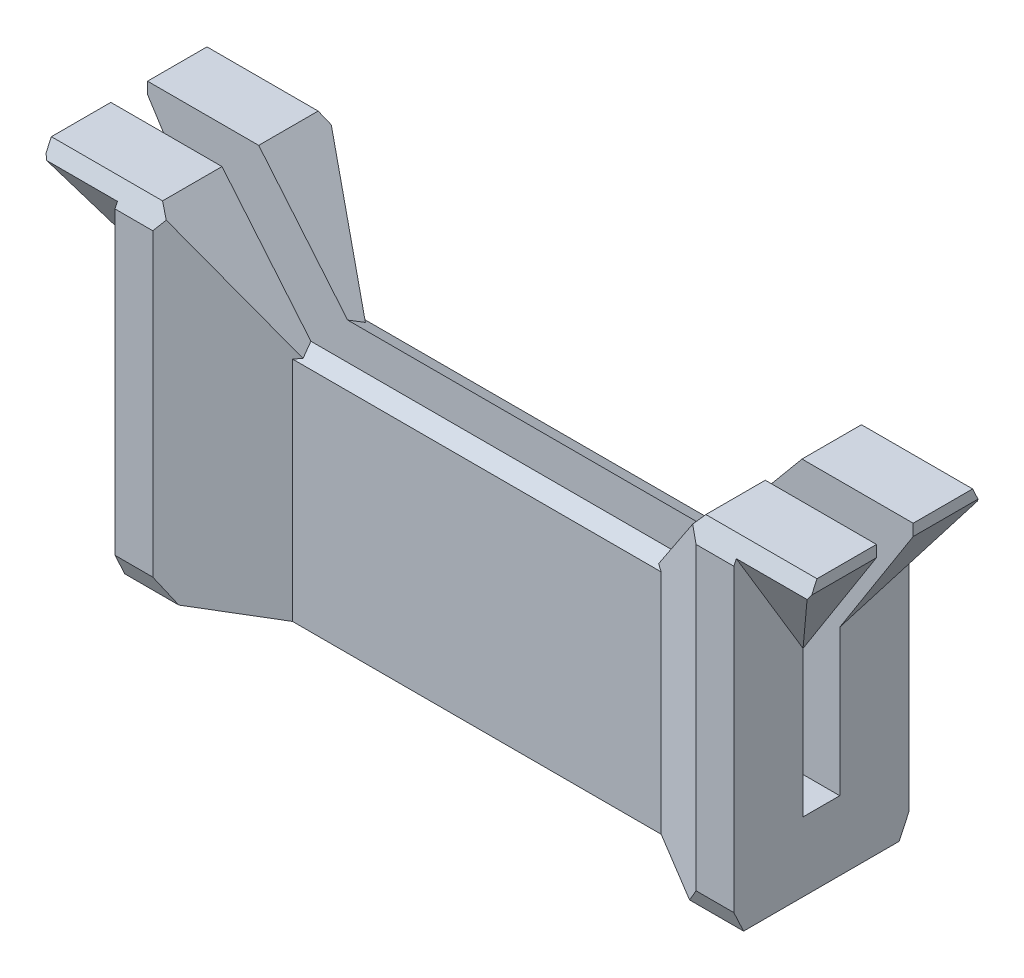
from build123d import *

# Parameters (mm, degrees)
SALIENTE_EXTRUIR1_DEPTH = 18.25
CORTAR_EXTRUIR1_START   = -1.8
CORTAR_EXTRUIR1_DEPTH   = 1.7
CORTAR_EXTRUIR2_DEPTH   = 25.823036176
CORTAR_EXTRUIR3_DEPTH   = 24.912026263
CORTAR_EXTRUIR4_REACH   = 37.713
CORTAR_EXTRUIR5_DEPTH   = 10
CHAFL_N2_SIZE           = 1
CHAFL_N2_SIZE_2         = 0.466307658


with BuildPart() as part:
    # Croquis2 → Saliente-Extruir1 (new, symmetric)
    with BuildSketch(Plane(origin=(0, 0, 0), x_dir=(0, 0, -1), z_dir=(1, 0, 0))):
        Polygon((0.875, 0), (0, 0), (0, -3.3), (0.875, -3.3), (4.175, 2.192122292), (4.175, 13), (0.875, 13), align=None)
        Polygon((0, 0), (-0.875, 0), (-0.875, 13), (-4.175, 13), (-4.175, 2.192122292), (-0.875, -3.3), (0, -3.3), align=None)
        Polygon((-4.175, -3.3), (-4.175, 2.192122292), (-0.875, -3.3), align=None)
        Polygon((4.175, -3.3), (0.875, -3.3), (4.175, 2.192122292), align=None)
    extrude(amount=SALIENTE_EXTRUIR1_DEPTH, both=True)

    # Croquis3 → Cortar-Extruir1 (cut)
    with BuildSketch(Plane(origin=(18.25, 0, 0), x_dir=(0, 0, -1), z_dir=(1, 0, 0)).offset(CORTAR_EXTRUIR1_START)):
        Polygon((0, -3.3), (0, 0), (-0.875, 0), (-0.875, 6.957676858), (-4.175, 12.449799149), (-4.175, -3.3), align=None)
        Polygon((0.875, 0), (0, 0), (0, -3.3), (4.175, -3.3), (4.175, 12.449799149), (0.875, 6.957676858), align=None)
    cortar_extruir1 = extrude(amount=-CORTAR_EXTRUIR1_DEPTH, mode=Mode.SUBTRACT)

    # Simetría1: Cortar-Extruir1 across plane
    add(cortar_extruir1.mirror(Plane(origin=(0, 0, 0), x_dir=(0, 0, 1), z_dir=(1, 0, 0))), mode=Mode.SUBTRACT)

    # Croquis4 → Cortar-Extruir2 (cut, through all)
    with BuildSketch(Plane(origin=(0, 13, 0), x_dir=(1, 0, 0), z_dir=(0, 1, 0))):
        Polygon((8.789301294, -1.675), (-8.789301294, -1.675), (-12.95, -4.175), (12.95, -4.175), align=None)
        Polygon((8.789301294, 1.675), (12.95, 4.175), (-12.95, 4.175), (-8.789301294, 1.675), align=None)
    extrude(amount=-CORTAR_EXTRUIR2_DEPTH, mode=Mode.SUBTRACT)

    # Croquis5 → Cortar-Extruir3 (cut, through all)
    with BuildSketch(Plane.XY.offset(4.175)):
        Polygon((-12.95, 13), (12.95, 13), (8.789301294, 8), (-8.789301294, 8), align=None)
    extrude(amount=-CORTAR_EXTRUIR3_DEPTH, mode=Mode.SUBTRACT)

    # Croquis6 → Cortar-Extruir4 (cut, up to next)
    with BuildSketch(Plane(origin=(14.75, 0, 0), x_dir=(0, 0, -1), z_dir=(1, 0, 0)), mode=Mode.PRIVATE) as cortar_extruir4_sk1:
        Polygon((-4.175, -3.3), (4.175, -3.3), (4.175, 12.449799149), (0.875, 6.957676858), (0.875, 0), (-0.875, 0), (-0.875, 6.957676858), (-4.175, 12.449799149), align=None)
    cortar_extruir4_tool1 = extrude(cortar_extruir4_sk1.sketch, amount=CORTAR_EXTRUIR4_REACH, mode=Mode.PRIVATE) & part.part
    cortar_extruir4 = cortar_extruir4_tool1.solids().sort_by_distance((14.75, -3.121737, 0))[0]
    add(cortar_extruir4, mode=Mode.SUBTRACT)

    # Simetría2: Cortar-Extruir4 across plane
    add(cortar_extruir4.mirror(Plane(origin=(0, 0, 0), x_dir=(0, 0, 1), z_dir=(1, 0, 0))), mode=Mode.SUBTRACT)

    # Croquis7 → Cortar-Extruir5 (cut)
    with BuildSketch(Plane(origin=(0, 0, -4.175), x_dir=(-1, 0, 0), z_dir=(0, 0, -1))):
        Polygon((14.75, 6.957676858), (18.25, 12.449799149), (18.25, 6.957676858), align=None)
        Polygon((-18.25, 6.957676858), (-14.75, 6.957676858), (-18.25, 12.449799149), align=None)
    extrude(amount=-CORTAR_EXTRUIR5_DEPTH, mode=Mode.SUBTRACT)

    # Chaflán2
    # the kernel refuses this chamfer: 1, 0.466307658 mm, written as the material it takes off along each edge
    with BuildSketch(Plane(origin=(-11.380276766, 8, 1.675), x_dir=(0, 0.01631116413111048, -0.9998669641130704), z_dir=(1, 0, 0))) as chafl_n2_piece_1_section:
        Polygon((CHAFL_N2_SIZE * 0.999866964113, -CHAFL_N2_SIZE * 0.0163111641311), (-CHAFL_N2_SIZE_2 * 0.0163111641365, -CHAFL_N2_SIZE_2 * 0.999866964445), (0, 0), align=None)
    chafl_n2_piece_1 = extrude(amount=22.760553531, mode=Mode.PRIVATE)
    chafl_n2_piece_1 = split(chafl_n2_piece_1, bisect_by=Plane(origin=(-8.557096722, 7.720954834, 1.652220127), z_dir=(-0.7686723090596509, -0.6396427763094841, 0)), keep=Keep.TOP, mode=Mode.PRIVATE)
    chafl_n2_piece_1 = split(chafl_n2_piece_1, bisect_by=Plane(origin=(-8.661655422, 7.660906137, 1.598302622), z_dir=(0.5150380749100552, 0, 0.8571673007021118)), keep=Keep.TOP, mode=Mode.PRIVATE)
    add(chafl_n2_piece_1, mode=Mode.SUBTRACT)
    with BuildSketch(Plane(origin=(-11.380276766, 8, 1.675), x_dir=(0, 0.01631116413111048, -0.9998669641130704), z_dir=(1, 0, 0))) as chafl_n2_piece_2_section:
        Polygon((CHAFL_N2_SIZE * 0.999866964113, -CHAFL_N2_SIZE * 0.0163111641311), (-CHAFL_N2_SIZE_2 * 0.0163111641365, -CHAFL_N2_SIZE_2 * 0.999866964445), (0, 0), align=None)
    chafl_n2_piece_2 = extrude(amount=22.760553531, mode=Mode.PRIVATE)
    chafl_n2_piece_2 = split(chafl_n2_piece_2, bisect_by=Plane(origin=(-8.541684452, 7.702433581, 1.094162821), z_dir=(0.7686723090596509, 0.6396427763094841, 0)), keep=Keep.TOP, mode=Mode.PRIVATE)
    chafl_n2_piece_2 = split(chafl_n2_piece_2, bisect_by=Plane(origin=(-8.154722375, 7.924668255, 1.293706518), z_dir=(-0.5150380749100552, 0, -0.8571673007021118)), keep=Keep.TOP, mode=Mode.PRIVATE)
    add(chafl_n2_piece_2, mode=Mode.SUBTRACT)
    with BuildSketch(Plane(origin=(-11.380276766, 8, 1.675), x_dir=(0, 0.01631116413111048, -0.9998669641130704), z_dir=(1, 0, 0))) as chafl_n2_piece_3_section:
        Polygon((CHAFL_N2_SIZE * 0.999866964113, -CHAFL_N2_SIZE * 0.0163111641311), (-CHAFL_N2_SIZE_2 * 0.0163111641365, -CHAFL_N2_SIZE_2 * 0.999866964445), (0, 0), align=None)
    chafl_n2_piece_3 = extrude(amount=22.760553531, mode=Mode.PRIVATE)
    chafl_n2_piece_3 = split(chafl_n2_piece_3, bisect_by=Plane(origin=(-5.119611659, 3.590056028, 1.349077222), z_dir=(0.7686723090596509, 0.6396427763094841, 0)), keep=Keep.TOP, mode=Mode.PRIVATE)
    chafl_n2_piece_3 = split(chafl_n2_piece_3, bisect_by=Plane(origin=(5.119611659, 3.590056028, 1.349077222), z_dir=(-0.768672309059651, 0.6396427763094839, 0)), keep=Keep.TOP, mode=Mode.PRIVATE)
    chafl_n2_piece_3 = split(chafl_n2_piece_3, bisect_by=Plane(origin=(2.187600774, 7.850288348, -2.291701861), z_dir=(-0.5150380749100552, 0, 0.8571673007021118)), keep=Keep.TOP, mode=Mode.PRIVATE)
    chafl_n2_piece_3 = split(chafl_n2_piece_3, bisect_by=Plane(origin=(-2.187600774, 7.850288348, -2.291701861), z_dir=(0.5150380749100552, 0, 0.8571673007021118)), keep=Keep.TOP, mode=Mode.PRIVATE)
    add(chafl_n2_piece_3, mode=Mode.SUBTRACT)
    with BuildSketch(Plane(origin=(-11.380276766, 8, 1.675), x_dir=(0, 0.01631116413111048, -0.9998669641130704), z_dir=(1, 0, 0))) as chafl_n2_piece_4_section:
        Polygon((CHAFL_N2_SIZE * 0.999866964113, -CHAFL_N2_SIZE * 0.0163111641311), (-CHAFL_N2_SIZE_2 * 0.0163111641365, -CHAFL_N2_SIZE_2 * 0.999866964445), (0, 0), align=None)
    chafl_n2_piece_4 = extrude(amount=22.760553531, mode=Mode.PRIVATE)
    chafl_n2_piece_4 = split(chafl_n2_piece_4, bisect_by=Plane(origin=(8.557096722, 7.720954834, 1.652220127), z_dir=(0.768672309059651, -0.6396427763094839, 0)), keep=Keep.TOP, mode=Mode.PRIVATE)
    chafl_n2_piece_4 = split(chafl_n2_piece_4, bisect_by=Plane(origin=(8.661655422, 7.660906137, 1.598302622), z_dir=(-0.5150380749100552, 0, 0.8571673007021118)), keep=Keep.TOP, mode=Mode.PRIVATE)
    add(chafl_n2_piece_4, mode=Mode.SUBTRACT)
    with BuildSketch(Plane(origin=(-11.380276766, 8, 1.675), x_dir=(0, 0.01631116413111048, -0.9998669641130704), z_dir=(1, 0, 0))) as chafl_n2_piece_5_section:
        Polygon((CHAFL_N2_SIZE * 0.999866964113, -CHAFL_N2_SIZE * 0.0163111641311), (-CHAFL_N2_SIZE_2 * 0.0163111641365, -CHAFL_N2_SIZE_2 * 0.999866964445), (0, 0), align=None)
    chafl_n2_piece_5 = extrude(amount=22.760553531, mode=Mode.PRIVATE)
    chafl_n2_piece_5 = split(chafl_n2_piece_5, bisect_by=Plane(origin=(8.541684452, 7.702433581, 1.094162821), z_dir=(-0.768672309059651, 0.6396427763094839, 0)), keep=Keep.TOP, mode=Mode.PRIVATE)
    chafl_n2_piece_5 = split(chafl_n2_piece_5, bisect_by=Plane(origin=(8.154722375, 7.924668255, 1.293706518), z_dir=(0.5150380749100552, 0, -0.8571673007021118)), keep=Keep.TOP, mode=Mode.PRIVATE)
    add(chafl_n2_piece_5, mode=Mode.SUBTRACT)
    with BuildSketch(Plane(origin=(11.380276766, 8, -1.675), x_dir=(0, -0.9971975577536775, -0.0748133063705994), z_dir=(-1, 0, 0))) as chafl_n2_piece_6_section:
        Polygon((CHAFL_N2_SIZE_2 * 0.997197558085, CHAFL_N2_SIZE_2 * 0.0748133063955), (-CHAFL_N2_SIZE * 0.0748133063706, CHAFL_N2_SIZE * 0.997197557754), (0, 0), align=None)
    chafl_n2_piece_6 = extrude(amount=22.760553531, mode=Mode.PRIVATE)
    chafl_n2_piece_6 = split(chafl_n2_piece_6, bisect_by=Plane(origin=(8.541684452, 7.702433581, -1.094162821), z_dir=(-0.768672309059651, 0.6396427763094839, 0)), keep=Keep.TOP, mode=Mode.PRIVATE)
    chafl_n2_piece_6 = split(chafl_n2_piece_6, bisect_by=Plane(origin=(8.154722375, 7.924668255, -1.293706518), z_dir=(0.5150380749100552, 0, 0.8571673007021118)), keep=Keep.TOP, mode=Mode.PRIVATE)
    add(chafl_n2_piece_6, mode=Mode.SUBTRACT)
    with BuildSketch(Plane(origin=(11.380276766, 8, -1.675), x_dir=(0, -0.9971975577536775, -0.0748133063705994), z_dir=(-1, 0, 0))) as chafl_n2_piece_7_section:
        Polygon((CHAFL_N2_SIZE_2 * 0.997197558085, CHAFL_N2_SIZE_2 * 0.0748133063955), (-CHAFL_N2_SIZE * 0.0748133063706, CHAFL_N2_SIZE * 0.997197557754), (0, 0), align=None)
    chafl_n2_piece_7 = extrude(amount=22.760553531, mode=Mode.PRIVATE)
    chafl_n2_piece_7 = split(chafl_n2_piece_7, bisect_by=Plane(origin=(8.557096722, 7.720954834, -1.652220127), z_dir=(0.768672309059651, -0.6396427763094839, 0)), keep=Keep.TOP, mode=Mode.PRIVATE)
    chafl_n2_piece_7 = split(chafl_n2_piece_7, bisect_by=Plane(origin=(8.661655422, 7.660906137, -1.598302622), z_dir=(-0.5150380749100552, 0, -0.8571673007021118)), keep=Keep.TOP, mode=Mode.PRIVATE)
    add(chafl_n2_piece_7, mode=Mode.SUBTRACT)
    with BuildSketch(Plane(origin=(11.380276766, 8, -1.675), x_dir=(0, -0.9971975577536775, -0.0748133063705994), z_dir=(-1, 0, 0))) as chafl_n2_piece_8_section:
        Polygon((CHAFL_N2_SIZE_2 * 0.997197558085, CHAFL_N2_SIZE_2 * 0.0748133063955), (-CHAFL_N2_SIZE * 0.0748133063706, CHAFL_N2_SIZE * 0.997197557754), (0, 0), align=None)
    chafl_n2_piece_8 = extrude(amount=22.760553531, mode=Mode.PRIVATE)
    chafl_n2_piece_8 = split(chafl_n2_piece_8, bisect_by=Plane(origin=(5.119611659, 3.590056028, -1.349077222), z_dir=(-0.768672309059651, 0.6396427763094839, 0)), keep=Keep.TOP, mode=Mode.PRIVATE)
    chafl_n2_piece_8 = split(chafl_n2_piece_8, bisect_by=Plane(origin=(2.187600774, 7.850288348, 2.291701861), z_dir=(-0.5150380749100552, 0, -0.8571673007021118)), keep=Keep.TOP, mode=Mode.PRIVATE)
    chafl_n2_piece_8 = split(chafl_n2_piece_8, bisect_by=Plane(origin=(-2.187600774, 7.850288348, 2.291701861), z_dir=(0.5150380749100552, 0, -0.8571673007021118)), keep=Keep.TOP, mode=Mode.PRIVATE)
    chafl_n2_piece_8 = split(chafl_n2_piece_8, bisect_by=Plane(origin=(-5.119611659, 3.590056028, -1.349077222), z_dir=(0.7686723090596509, 0.6396427763094841, 0)), keep=Keep.TOP, mode=Mode.PRIVATE)
    add(chafl_n2_piece_8, mode=Mode.SUBTRACT)
    with BuildSketch(Plane(origin=(11.380276766, 8, -1.675), x_dir=(0, -0.9971975577536775, -0.0748133063705994), z_dir=(-1, 0, 0))) as chafl_n2_piece_9_section:
        Polygon((CHAFL_N2_SIZE_2 * 0.997197558085, CHAFL_N2_SIZE_2 * 0.0748133063955), (-CHAFL_N2_SIZE * 0.0748133063706, CHAFL_N2_SIZE * 0.997197557754), (0, 0), align=None)
    chafl_n2_piece_9 = extrude(amount=22.760553531, mode=Mode.PRIVATE)
    chafl_n2_piece_9 = split(chafl_n2_piece_9, bisect_by=Plane(origin=(-8.154722375, 7.924668255, -1.293706518), z_dir=(-0.5150380749100552, 0, 0.8571673007021118)), keep=Keep.TOP, mode=Mode.PRIVATE)
    chafl_n2_piece_9 = split(chafl_n2_piece_9, bisect_by=Plane(origin=(-8.541684452, 7.702433581, -1.094162821), z_dir=(0.7686723090596509, 0.6396427763094841, 0)), keep=Keep.TOP, mode=Mode.PRIVATE)
    add(chafl_n2_piece_9, mode=Mode.SUBTRACT)
    with BuildSketch(Plane(origin=(11.380276766, 8, -1.675), x_dir=(0, -0.9971975577536775, -0.0748133063705994), z_dir=(-1, 0, 0))) as chafl_n2_piece_10_section:
        Polygon((CHAFL_N2_SIZE_2 * 0.997197558085, CHAFL_N2_SIZE_2 * 0.0748133063955), (-CHAFL_N2_SIZE * 0.0748133063706, CHAFL_N2_SIZE * 0.997197557754), (0, 0), align=None)
    chafl_n2_piece_10 = extrude(amount=22.760553531, mode=Mode.PRIVATE)
    chafl_n2_piece_10 = split(chafl_n2_piece_10, bisect_by=Plane(origin=(-8.661655422, 7.660906137, -1.598302622), z_dir=(0.5150380749100552, 0, -0.8571673007021118)), keep=Keep.TOP, mode=Mode.PRIVATE)
    chafl_n2_piece_10 = split(chafl_n2_piece_10, bisect_by=Plane(origin=(-8.557096722, 7.720954834, -1.652220127), z_dir=(-0.7686723090596509, -0.6396427763094841, 0)), keep=Keep.TOP, mode=Mode.PRIVATE)
    add(chafl_n2_piece_10, mode=Mode.SUBTRACT)
    with BuildSketch(Plane(origin=(20.840975471, 13, 4.175), x_dir=(0, -0.9998669641130704, 0.016311164131110487), z_dir=(-1, 0, 0)), Plane(origin=(-20.840975471, 13, -4.175), x_dir=(0, -0.9998669641130704, -0.016311164131110487), z_dir=(1, 0, 0))) as chafl_n2_piece_11:
        Polygon((CHAFL_N2_SIZE * 0.999866964113, -CHAFL_N2_SIZE * 0.0163111641311), (-CHAFL_N2_SIZE_2 * 0.0163111641365, -CHAFL_N2_SIZE_2 * 0.999866964445), (0, 0), align=None)
    extrude(amount=10.481950943, mode=Mode.SUBTRACT)
    with BuildSketch(Plane(origin=(10.359024529, -3.3, 4.175), x_dir=(0, 0.9998669641130704, 0.01631116413111048), z_dir=(1, 0, 0)), Plane(origin=(-17.340975471, -3.3, 4.175), x_dir=(0, 0.9998669641130704, 0.01631116413111048), z_dir=(1, 0, 0))) as chafl_n2_piece_12:
        Polygon((CHAFL_N2_SIZE * 0.999866964113, -CHAFL_N2_SIZE * 0.0163111641311), (-CHAFL_N2_SIZE_2 * 0.0163111641365, -CHAFL_N2_SIZE_2 * 0.999866964445), (0, 0), align=None)
    extrude(amount=6.981950943, mode=Mode.SUBTRACT)
    with BuildSketch(Plane(origin=(-10.359024529, 13, 4.175), x_dir=(0, 0.07481330637059887, -0.9971975577536775), z_dir=(-1, 0, 0)), Plane(origin=(10.359024529, 13, -4.175), x_dir=(0, 0.07481330637059887, 0.9971975577536775), z_dir=(1, 0, 0))) as chafl_n2_piece_13:
        Polygon((CHAFL_N2_SIZE_2 * 0.997197558085, CHAFL_N2_SIZE_2 * 0.0748133063955), (-CHAFL_N2_SIZE * 0.0748133063706, CHAFL_N2_SIZE * 0.997197557754), (0, 0), align=None)
    extrude(amount=10.481950943, mode=Mode.SUBTRACT)
    with BuildSketch(Plane(origin=(-17.340975471, -3.3, -4.175), x_dir=(0, 0.9998669641130704, -0.01631116413111048), z_dir=(1, 0, 0)), Plane(origin=(10.359024529, -3.3, -4.175), x_dir=(0, 0.9998669641130704, -0.01631116413111048), z_dir=(1, 0, 0))) as chafl_n2_piece_14:
        Polygon((CHAFL_N2_SIZE * 0.999866964113, CHAFL_N2_SIZE * 0.0163111641311), (-CHAFL_N2_SIZE_2 * 0.0163111641365, CHAFL_N2_SIZE_2 * 0.999866964445), (0, 0), align=None)
    extrude(amount=6.981950943, mode=Mode.SUBTRACT)


solid = part.part
